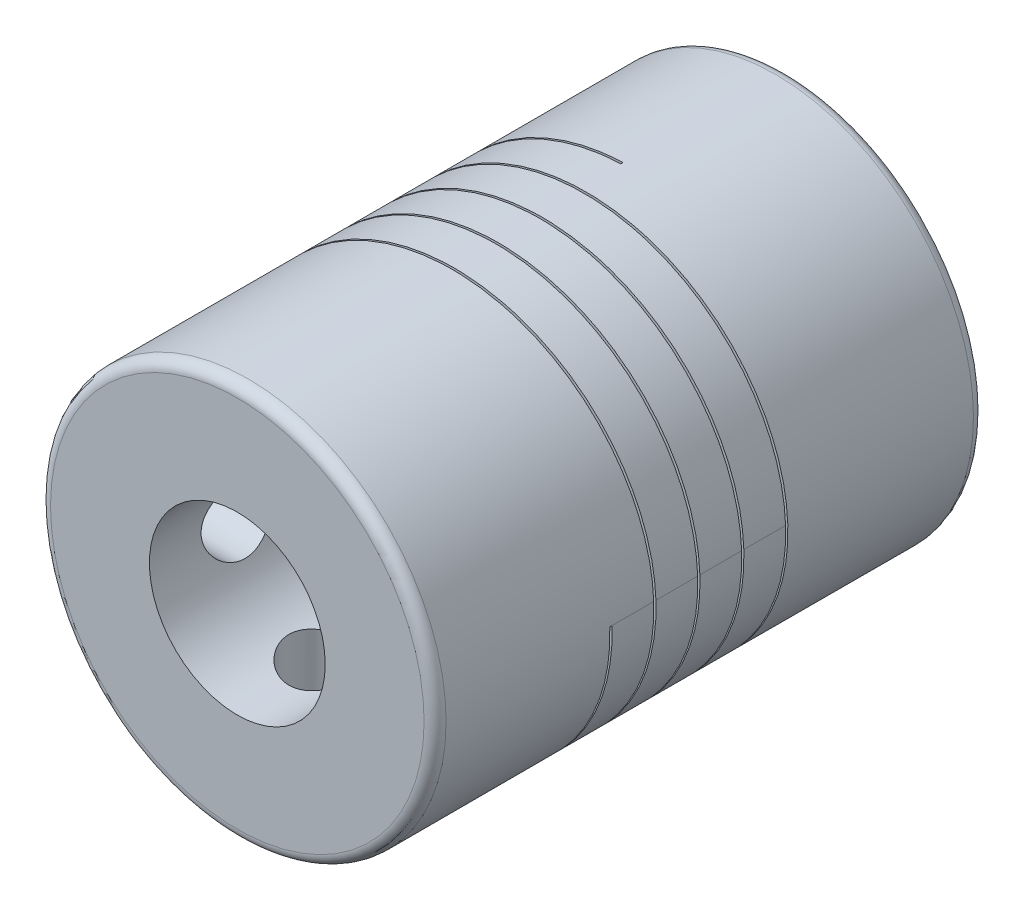
from build123d import *

# Parameters (mm, degrees)
SKETCH1_R             = 9
BOSS_EXTRUDE1_DEPTH   = 25
FILLET1_R             = 0.5
SKETCH2_R             = 4
CUT_EXTRUDE1_DEPTH    = 17
SKETCH3_R             = 3
CUT_EXTRUDE2_DEPTH    = 29.05352031
CUT_SWEEP1_PITCH      = 2
M4_TAPPED_HOLE1_D     = 3.3
M4_TAPPED_HOLE1_DEPTH = 8.1
M4_TAPPED_HOLE1_TIP   = 0.991420021
M4_TAPPED_HOLE2_D     = 3.3
M4_TAPPED_HOLE2_DEPTH = 8.1
M4_TAPPED_HOLE2_TIP   = 0.991420021


with BuildPart() as part:
    # Sketch1 → Boss-Extrude1 (new body)
    with BuildSketch(Plane.XY):
        Circle(SKETCH1_R)
    extrude(amount=BOSS_EXTRUDE1_DEPTH)

    # Fillet1
    fillet1_edges = [part.edges().sort_by_distance(p)[0] for p in [
        (-9, 0, 0),
        (-9, 0, 25),
    ]]
    fillet(fillet1_edges, radius=FILLET1_R)

    # Sketch2 → Cut-Extrude1 (cut)
    with BuildSketch(Plane.XY.offset(25)):
        Circle(SKETCH2_R)
    extrude(amount=-CUT_EXTRUDE1_DEPTH, mode=Mode.SUBTRACT)

    # Sketch3 → Cut-Extrude2 (cut, through all)
    with BuildSketch(Plane(origin=(0, 0, 0), x_dir=(-1, 0, 0), z_dir=(0, 0, -1))):
        Circle(SKETCH3_R)
    extrude(amount=-CUT_EXTRUDE2_DEPTH, mode=Mode.SUBTRACT)

    # Cut-Sweep1: the profile of Sketch8 screwed along a right-hand helix of 4.75 turns, 10 arcs to a turn; built about Z, then put on its axis
    cut_sweep1_z = Axis((0, 0, 0), (0, 0, 1))
    cut_sweep1_corners = [(17, 0, 0.05), (1, 0, 0.05), (1, 0, -0.05), (17, 0, -0.05)]
    with BuildLine(mode=Mode.PRIVATE) as cut_sweep1_profile:
        Line(cut_sweep1_corners[0], cut_sweep1_corners[1])
        Line(cut_sweep1_corners[1], cut_sweep1_corners[2])
        Line(cut_sweep1_corners[2], cut_sweep1_corners[3])
        Line(cut_sweep1_corners[3], cut_sweep1_corners[0])
    cut_sweep1_cap = Face(cut_sweep1_profile.wire())
    cut_sweep1_turn_angles = [0, 18, 36, 54, 72, 90, 108, 126, 144, 162, 180, 198, 216, 234, 252, 270, 288, 306, 324, 342, 360]
    cut_sweep1_turn_weights = [1, 0.9510565162951535, 1, 0.9510565162951535, 1, 0.9510565162951535, 1, 0.9510565162951535, 1, 0.9510565162951535, 1, 0.9510565162951535, 1, 0.9510565162951535, 1, 0.9510565162951535, 1, 0.9510565162951535, 1, 0.9510565162951535, 1]
    cut_sweep1_turn_rails = [Edge.make_bspline([Vector(p[0], p[1], 0).rotate(cut_sweep1_z, cut_sweep1_turn_angles[k]) / cut_sweep1_turn_weights[k] + Vector(0, 0, p[2] + CUT_SWEEP1_PITCH * cut_sweep1_turn_angles[k] / 360) for k in range(21)], [0, 0, 0, 1, 1, 2, 2, 3, 3, 4, 4, 5, 5, 6, 6, 7, 7, 8, 8, 9, 9, 10, 10, 10], 2, cut_sweep1_turn_weights) for p in cut_sweep1_corners]
    cut_sweep1_turn_sides = [Face.make_surface_from_curves(cut_sweep1_turn_rails[p[0]], cut_sweep1_turn_rails[p[1]]) for p in [(0, 1), (1, 2), (2, 3), (3, 0)]]
    cut_sweep1_last_angles = [1440, 1458, 1476, 1494, 1512, 1530, 1548, 1566, 1584, 1602, 1620, 1638, 1656, 1674, 1692, 1701, 1710]
    cut_sweep1_last_weights = [1, 0.9510565162951535, 1, 0.9510565162951535, 1, 0.9510565162951535, 1, 0.9510565162951535, 1, 0.9510565162951535, 1, 0.9510565162951535, 1, 0.9510565162951535, 1, 0.9876883405951343, 1]
    cut_sweep1_last_rails = [Edge.make_bspline([Vector(p[0], p[1], 0).rotate(cut_sweep1_z, cut_sweep1_last_angles[k]) / cut_sweep1_last_weights[k] + Vector(0, 0, p[2] + CUT_SWEEP1_PITCH * cut_sweep1_last_angles[k] / 360) for k in range(17)], [0, 0, 0, 1, 1, 2, 2, 3, 3, 4, 4, 5, 5, 6, 6, 7, 7, 8, 8, 8], 2, cut_sweep1_last_weights) for p in cut_sweep1_corners]
    cut_sweep1_last_sides = [Face.make_surface_from_curves(cut_sweep1_last_rails[p[0]], cut_sweep1_last_rails[p[1]]) for p in [(0, 1), (1, 2), (2, 3), (3, 0)]]
    cut_sweep1 = Plane(origin=(0, 0, 17), x_dir=(1, 0, 0), z_dir=(0, 0, -1)) * Solid(Shell([*[p.moved(Location((0, 0, CUT_SWEEP1_PITCH * i))) for i in range(4) for p in cut_sweep1_turn_sides], *cut_sweep1_last_sides, cut_sweep1_cap, cut_sweep1_cap.rotate(cut_sweep1_z, 1710).moved(Location((0, 0, CUT_SWEEP1_PITCH * 1710 / 360)))]))
    add(cut_sweep1, mode=Mode.SUBTRACT)

    # M4 Tapped Hole1
    with Locations(Plane.ZY.offset(9)):
        with Locations((4, 0), (21, 0)):
            Hole(M4_TAPPED_HOLE1_D / 2, depth=M4_TAPPED_HOLE1_DEPTH)
            with Locations((0, 0, -(M4_TAPPED_HOLE1_DEPTH + M4_TAPPED_HOLE1_TIP / 2))):  # 118° drill point
                Cone(0, M4_TAPPED_HOLE1_D / 2, M4_TAPPED_HOLE1_TIP, mode=Mode.SUBTRACT)

    # M4 Tapped Hole2
    with Locations(Plane(origin=(0, -9, 0), x_dir=(-1, 0, 0), z_dir=(0, -1, 0))):
        with Locations((0, -21), (0, -4)):
            Hole(M4_TAPPED_HOLE2_D / 2, depth=M4_TAPPED_HOLE2_DEPTH)
            with Locations((0, 0, -(M4_TAPPED_HOLE2_DEPTH + M4_TAPPED_HOLE2_TIP / 2))):  # 118° drill point
                Cone(0, M4_TAPPED_HOLE2_D / 2, M4_TAPPED_HOLE2_TIP, mode=Mode.SUBTRACT)


solid = part.part
